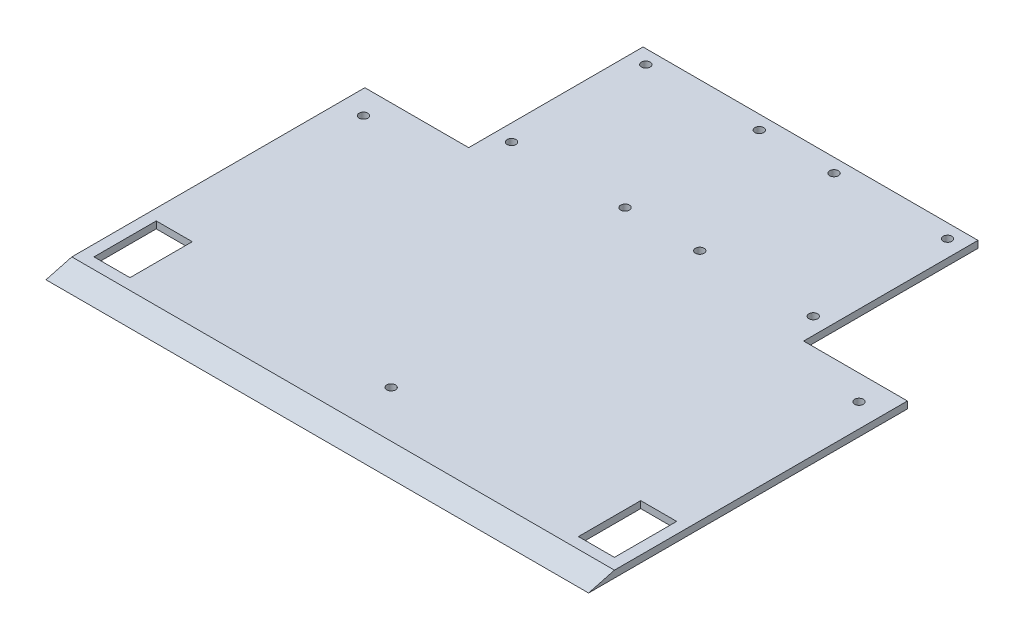
from build123d import *

# Parameters (mm, degrees)
SALIENTE_EXTRUIR1_DEPTH = 196
CORTAR_EXTRUIR1_REACH   = 266.89
CROQUIS2_W              = 37.5
CROQUIS2_H              = 62.989872981
CORTAR_EXTRUIR2_REACH   = 266.89
CROQUIS4_W              = 13
CROQUIS4_H              = 22.5
CUT_EXTRUDE1_REACH      = 266.89
SKETCH1_R               = 1.585
CUT_EXTRUDE2_REACH      = 266.89
SKETCH2_R               = 1.585
CUT_EXTRUDE3_REACH      = 266.89
SKETCH3_R               = 1.585


with BuildPart() as part:
    # Croquis1 → Saliente-Extruir1 (new body)
    with BuildSketch(Plane(origin=(0, 0, 0), x_dir=(0, 0, -1), z_dir=(1, 0, 0))):
        Polygon((0, 0), (178.17, 0), (178.17, 2.5), (9.330127019, 2.5), align=None)
    extrude(amount=SALIENTE_EXTRUIR1_DEPTH)

    # Croquis2 → Cortar-Extruir1 (cut, up to next)
    with BuildSketch(Plane(origin=(0, 0, 0), x_dir=(-1, 0, 0), z_dir=(0, -1, 0)), mode=Mode.PRIVATE) as cortar_extruir1_sk1:
        with Locations((-18.75, 146.67506351)):
            Rectangle(CROQUIS2_W, CROQUIS2_H)
    cortar_extruir1_tool1 = extrude(cortar_extruir1_sk1.sketch, amount=-CORTAR_EXTRUIR1_REACH, mode=Mode.PRIVATE) & part.part
    # Croquis2 → Cortar-Extruir1 (cut, up to next)
    with BuildSketch(Plane(origin=(0, 0, 0), x_dir=(-1, 0, 0), z_dir=(0, -1, 0)), mode=Mode.PRIVATE) as cortar_extruir1_sk2:
        with Locations((-177.25, 146.67506351)):
            Rectangle(CROQUIS2_W, CROQUIS2_H)
    cortar_extruir1_tool2 = extrude(cortar_extruir1_sk2.sketch, amount=-CORTAR_EXTRUIR1_REACH, mode=Mode.PRIVATE) & part.part
    add(cortar_extruir1_tool1.solids().sort_by_distance((18.75, 0, -146.675064))[0], mode=Mode.SUBTRACT)
    add(cortar_extruir1_tool2.solids().sort_by_distance((177.25, 0, -146.675064))[0], mode=Mode.SUBTRACT)

    # Croquis4 → Cortar-Extruir2 (cut, up to next)
    with BuildSketch(Plane(origin=(0, 2.5, 0), x_dir=(1, 0, 0), z_dir=(0, 1, 0)), mode=Mode.PRIVATE) as cortar_extruir2_sk1:
        with Locations((10.5, 24.580127019)):
            Rectangle(CROQUIS4_W, CROQUIS4_H)
    cortar_extruir2_tool1 = extrude(cortar_extruir2_sk1.sketch, amount=-CORTAR_EXTRUIR2_REACH, mode=Mode.PRIVATE) & part.part
    cortar_extruir2 = cortar_extruir2_tool1.solids().sort_by_distance((10.5, 2.5, -24.580127))[0]
    add(cortar_extruir2, mode=Mode.SUBTRACT)

    # Simetría1: Cortar-Extruir2 across plane
    add(cortar_extruir2.mirror(Plane(origin=(98, 0, 0), x_dir=(0, 0, 1), z_dir=(1, 0, 0))), mode=Mode.SUBTRACT)

    # Sketch1 → Cut-Extrude1 (cut, up to next)
    with BuildSketch(Plane(origin=(0, 2.5, 0), x_dir=(1, 0, 0), z_dir=(0, 1, 0)), mode=Mode.PRIVATE) as cut_extrude1_sk1:
        with Locations((187.5, 106.180127019)):
            Circle(SKETCH1_R)
    cut_extrude1_tool1 = extrude(cut_extrude1_sk1.sketch, amount=-CUT_EXTRUDE1_REACH, mode=Mode.PRIVATE) & part.part
    # Sketch1 → Cut-Extrude1 (cut, up to next)
    with BuildSketch(Plane(origin=(0, 2.5, 0), x_dir=(1, 0, 0), z_dir=(0, 1, 0)), mode=Mode.PRIVATE) as cut_extrude1_sk2:
        with Locations((8.5, 106.180127019)):
            Circle(SKETCH1_R)
    cut_extrude1_tool2 = extrude(cut_extrude1_sk2.sketch, amount=-CUT_EXTRUDE1_REACH, mode=Mode.PRIVATE) & part.part
    add(cut_extrude1_tool1.solids().sort_by_distance((187.5, 2.5, -106.180127))[0], mode=Mode.SUBTRACT)
    add(cut_extrude1_tool2.solids().sort_by_distance((8.5, 2.5, -106.180127))[0], mode=Mode.SUBTRACT)

    # Sketch2 → Cut-Extrude2 (cut, up to next)
    with BuildSketch(Plane(origin=(0, 2.5, 0), x_dir=(1, 0, 0), z_dir=(0, 1, 0)), mode=Mode.PRIVATE) as cut_extrude2_sk1:
        with Locations((98.5, 26.180127019)):
            Circle(SKETCH2_R)
    cut_extrude2_tool1 = extrude(cut_extrude2_sk1.sketch, amount=-CUT_EXTRUDE2_REACH, mode=Mode.PRIVATE) & part.part
    add(cut_extrude2_tool1.solids().sort_by_distance((98.5, 2.5, -26.180127))[0], mode=Mode.SUBTRACT)

    # Sketch3 → Cut-Extrude3 (cut, up to next)
    with BuildSketch(Plane(origin=(0, 2.5, 0), x_dir=(1, 0, 0), z_dir=(0, 1, 0)), mode=Mode.PRIVATE) as cut_extrude3_sk1:
        with Locations((111.5, 124.67)):
            Circle(SKETCH3_R)
    cut_extrude3_tool1 = extrude(cut_extrude3_sk1.sketch, amount=-CUT_EXTRUDE3_REACH, mode=Mode.PRIVATE) & part.part
    # Sketch3 → Cut-Extrude3 (cut, up to next)
    with BuildSketch(Plane(origin=(0, 2.5, 0), x_dir=(1, 0, 0), z_dir=(0, 1, 0)), mode=Mode.PRIVATE) as cut_extrude3_sk2:
        with Locations((152.5, 124.67)):
            Circle(SKETCH3_R)
    cut_extrude3_tool2 = extrude(cut_extrude3_sk2.sketch, amount=-CUT_EXTRUDE3_REACH, mode=Mode.PRIVATE) & part.part
    # Sketch3 → Cut-Extrude3 (cut, up to next)
    with BuildSketch(Plane(origin=(0, 2.5, 0), x_dir=(1, 0, 0), z_dir=(0, 1, 0)), mode=Mode.PRIVATE) as cut_extrude3_sk3:
        with Locations((152.5, 173.17)):
            Circle(SKETCH3_R)
    cut_extrude3_tool3 = extrude(cut_extrude3_sk3.sketch, amount=-CUT_EXTRUDE3_REACH, mode=Mode.PRIVATE) & part.part
    # Sketch3 → Cut-Extrude3 (cut, up to next)
    with BuildSketch(Plane(origin=(0, 2.5, 0), x_dir=(1, 0, 0), z_dir=(0, 1, 0)), mode=Mode.PRIVATE) as cut_extrude3_sk4:
        with Locations((111.5, 173.17)):
            Circle(SKETCH3_R)
    cut_extrude3_tool4 = extrude(cut_extrude3_sk4.sketch, amount=-CUT_EXTRUDE3_REACH, mode=Mode.PRIVATE) & part.part
    # Sketch3 → Cut-Extrude3 (cut, up to next)
    with BuildSketch(Plane(origin=(0, 2.5, 0), x_dir=(1, 0, 0), z_dir=(0, 1, 0)), mode=Mode.PRIVATE) as cut_extrude3_sk5:
        with Locations((84.5, 173.17)):
            Circle(SKETCH3_R)
    cut_extrude3_tool5 = extrude(cut_extrude3_sk5.sketch, amount=-CUT_EXTRUDE3_REACH, mode=Mode.PRIVATE) & part.part
    # Sketch3 → Cut-Extrude3 (cut, up to next)
    with BuildSketch(Plane(origin=(0, 2.5, 0), x_dir=(1, 0, 0), z_dir=(0, 1, 0)), mode=Mode.PRIVATE) as cut_extrude3_sk6:
        with Locations((43.5, 173.17)):
            Circle(SKETCH3_R)
    cut_extrude3_tool6 = extrude(cut_extrude3_sk6.sketch, amount=-CUT_EXTRUDE3_REACH, mode=Mode.PRIVATE) & part.part
    # Sketch3 → Cut-Extrude3 (cut, up to next)
    with BuildSketch(Plane(origin=(0, 2.5, 0), x_dir=(1, 0, 0), z_dir=(0, 1, 0)), mode=Mode.PRIVATE) as cut_extrude3_sk7:
        with Locations((43.5, 124.67)):
            Circle(SKETCH3_R)
    cut_extrude3_tool7 = extrude(cut_extrude3_sk7.sketch, amount=-CUT_EXTRUDE3_REACH, mode=Mode.PRIVATE) & part.part
    # Sketch3 → Cut-Extrude3 (cut, up to next)
    with BuildSketch(Plane(origin=(0, 2.5, 0), x_dir=(1, 0, 0), z_dir=(0, 1, 0)), mode=Mode.PRIVATE) as cut_extrude3_sk8:
        with Locations((84.5, 124.67)):
            Circle(SKETCH3_R)
    cut_extrude3_tool8 = extrude(cut_extrude3_sk8.sketch, amount=-CUT_EXTRUDE3_REACH, mode=Mode.PRIVATE) & part.part
    add(cut_extrude3_tool1.solids().sort_by_distance((111.5, 2.5, -124.67))[0], mode=Mode.SUBTRACT)
    add(cut_extrude3_tool2.solids().sort_by_distance((152.5, 2.5, -124.67))[0], mode=Mode.SUBTRACT)
    add(cut_extrude3_tool3.solids().sort_by_distance((152.5, 2.5, -173.17))[0], mode=Mode.SUBTRACT)
    add(cut_extrude3_tool4.solids().sort_by_distance((111.5, 2.5, -173.17))[0], mode=Mode.SUBTRACT)
    add(cut_extrude3_tool5.solids().sort_by_distance((84.5, 2.5, -173.17))[0], mode=Mode.SUBTRACT)
    add(cut_extrude3_tool6.solids().sort_by_distance((43.5, 2.5, -173.17))[0], mode=Mode.SUBTRACT)
    add(cut_extrude3_tool7.solids().sort_by_distance((43.5, 2.5, -124.67))[0], mode=Mode.SUBTRACT)
    add(cut_extrude3_tool8.solids().sort_by_distance((84.5, 2.5, -124.67))[0], mode=Mode.SUBTRACT)


solid = part.part
